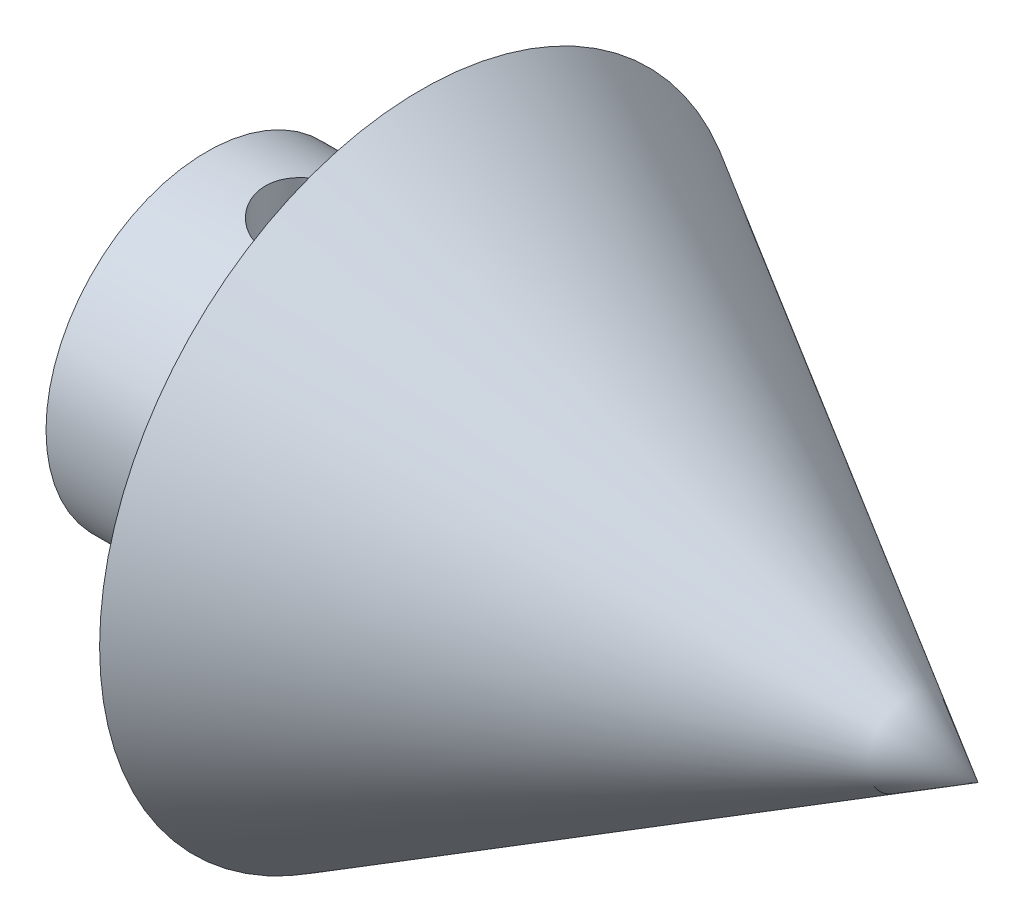
from build123d import *

# Parameters (mm, degrees)
CROQUIS1_R              = 7.5
SALIENTE_EXTRUIR1_DEPTH = 10
CROQUIS5_R              = 4.05
CORTAR_EXTRUIR1_DEPTH   = 15
CROQUIS9_W              = 2.25
CROQUIS9_H              = 7.5


with BuildPart() as part:
    # Croquis1 → Saliente-Extruir1 (new body)
    with BuildSketch(Plane(origin=(0, 0, 0), x_dir=(0, 0, -1), z_dir=(1, 0, 0))):
        Circle(CROQUIS1_R)
    extrude(amount=SALIENTE_EXTRUIR1_DEPTH)


with BuildPart() as body_2:
    # Saliente-Extruir2 cone 1 section (through the dimple's axis) → Saliente-Extruir2 (revolve)
    with BuildSketch(Plane(origin=(10, 0, 0), x_dir=(0, 0, 1), z_dir=(0, 1, 0))):
        Polygon((0, 0), (15, 0), (0, 25.980762114), align=None)
    revolve(axis=Axis((10, 0, 0), (1, 0, 0)))


with BuildPart() as cortar_extruir1_tool:
    # Croquis5 → Cortar-Extruir1 (new body)
    with BuildSketch(Plane.ZY):
        Circle(CROQUIS5_R)
    extrude(amount=-CORTAR_EXTRUIR1_DEPTH)


with BuildPart() as part_1:
    add(part.part)

    # Cortar-Extruir1: cut by cortar_extruir1_tool
    add(cortar_extruir1_tool.part, mode=Mode.SUBTRACT)

    # Croquis9 → Taladro de margen para M41 (revolve, cut)
    with BuildSketch(Plane(origin=(4.999975966, 7.499983977, 0.015502848), x_dir=(0, -0.002067046378874128, 0.999997863657352), z_dir=(1, 0, 0))):
        with Locations((1.125, 3.75)):
            Rectangle(CROQUIS9_W, CROQUIS9_H)
    revolve(axis=Axis((4.999975966, 13.849970412, 0.028628592), (0, -0.9999978636573518, -0.0020670463788741277)), mode=Mode.SUBTRACT)


with BuildPart() as body_2_1:
    add(body_2.part)

    # Cortar-Extruir1: cut by cortar_extruir1_tool
    add(cortar_extruir1_tool.part, mode=Mode.SUBTRACT)


solid = Compound([part_1.part, body_2_1.part])
